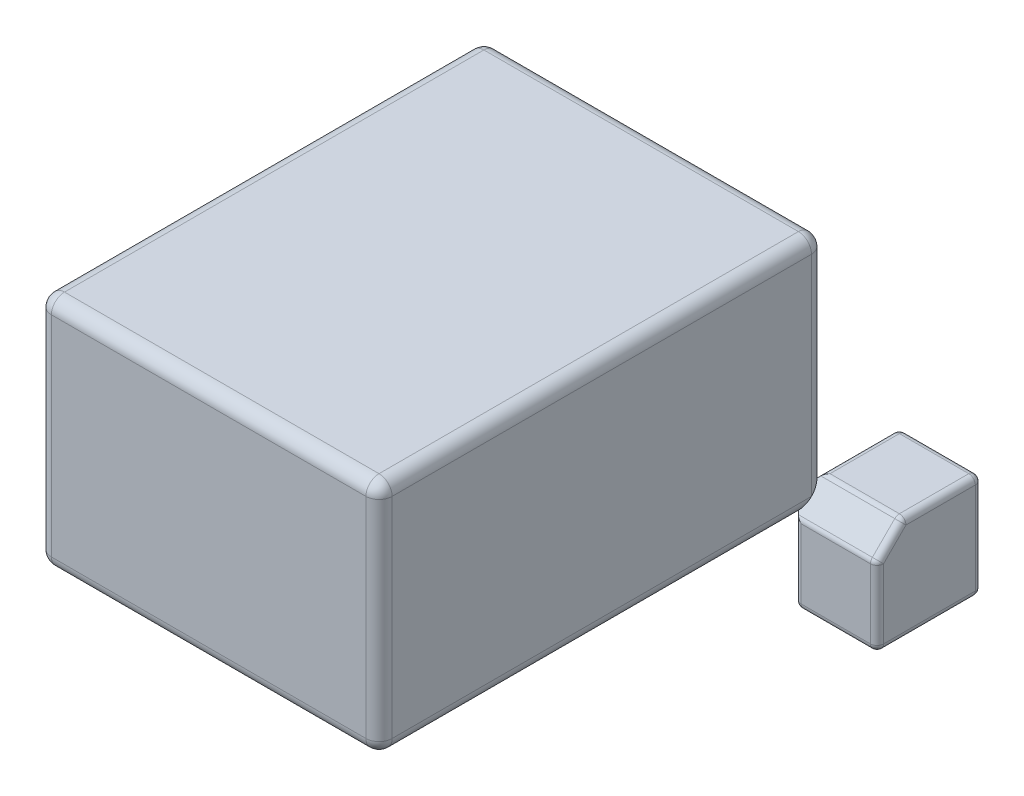
from build123d import *

# Parameters (mm, degrees)
SKETCH1_W                = 26
SKETCH1_H                = 18
BOSS_EXTRUDE1_DEPTH      = 34
SHELL1_T                 = 1
BOSS_EXTRUDE3_DEPTH      = 6
BOSS_EXTRUDE3_DEPTH_BACK = 2
SKETCH2_W                = 8
SKETCH2_H                = 8
CHAMFER2_SIZE            = 2
FILLET1_R                = 1
FILLET2_R                = 0.5


with BuildPart() as part:
    # Sketch1 → Boss-Extrude1 (new body)
    with BuildSketch(Plane.XY):
        with Locations((13, 9)):
            Rectangle(SKETCH1_W, SKETCH1_H)
    extrude(amount=BOSS_EXTRUDE1_DEPTH)

    # Shell1 (no face opened: a closed hollow body)
    add(offset(amount=-SHELL1_T, mode=Mode.PRIVATE), mode=Mode.SUBTRACT)

    # Sketch2 → Boss-Extrude3 (add, two sides: drawn at the far end of the back side and taken through both)
    with BuildSketch(Plane(origin=(0, 0, 0), x_dir=(-1, 0, 0), z_dir=(0, 0, -1)).offset(-BOSS_EXTRUDE3_DEPTH_BACK)):
        with Locations((-28, -2)):
            Rectangle(SKETCH2_W, SKETCH2_H)
    extrude(amount=BOSS_EXTRUDE3_DEPTH + BOSS_EXTRUDE3_DEPTH_BACK)

    # Chamfer2
    chamfer2_edges = [part.edges().sort_by_distance(p)[0] for p in [
        (24, -3, 2),
        (24, 2, -3),
        (29, 2, 2),
    ]]
    chamfer(chamfer2_edges, length=CHAMFER2_SIZE)

    # Fillet1
    # the kernel refuses this fillet: 1 mm, written as the material it takes off along each edge
    with BuildSketch(Plane(origin=(1, 17, 1), x_dir=(0, 1, 0), z_dir=(0, 0, -1))) as fillet1_piece_1_section:
        Polygon((0, 0), (FILLET1_R, 0), (FILLET1_R, -FILLET1_R), (0, -FILLET1_R), align=None)
    fillet1_piece_1 = extrude(amount=FILLET1_R, mode=Mode.PRIVATE)
    fillet1_piece_1 = fillet1_piece_1 - Plane(origin=(1, 17, 1), x_dir=(0.7071067811865476, -0.7071067811865475, 0), z_dir=(0, 0, -1)) * Sphere(FILLET1_R, mode=Mode.PRIVATE)
    add(fillet1_piece_1, mode=Mode.SUBTRACT)
    with BuildSketch(Plane(origin=(1, 1, 1), x_dir=(0, 0, -1), z_dir=(0, -1, 0))) as fillet1_piece_2_section:
        Polygon((0, 0), (FILLET1_R, 0), (FILLET1_R, -FILLET1_R), (0, -FILLET1_R), align=None)
    fillet1_piece_2 = extrude(amount=FILLET1_R, mode=Mode.PRIVATE)
    fillet1_piece_2 = fillet1_piece_2 - Plane(origin=(1, 1, 1), x_dir=(0.7071067811865475, 0, 0.7071067811865475), z_dir=(0, -1, 0)) * Sphere(FILLET1_R, mode=Mode.PRIVATE)
    add(fillet1_piece_2, mode=Mode.SUBTRACT)
    with BuildSketch(Plane(origin=(25, 17, 1), x_dir=(0, 0, -1), z_dir=(0, 1, 0))) as fillet1_piece_3_section:
        Polygon((0, 0), (FILLET1_R, 0), (FILLET1_R, -FILLET1_R), (0, -FILLET1_R), align=None)
    fillet1_piece_3 = extrude(amount=FILLET1_R, mode=Mode.PRIVATE)
    fillet1_piece_3 = fillet1_piece_3 - Plane(origin=(25, 17, 1), x_dir=(-0.7071067811865475, 0, 0.7071067811865475), z_dir=(0, 1, 0)) * Sphere(FILLET1_R, mode=Mode.PRIVATE)
    add(fillet1_piece_3, mode=Mode.SUBTRACT)
    with BuildSketch(Plane(origin=(1, 1, 33), x_dir=(-1, 0, 0), z_dir=(0, -1, 0))) as fillet1_piece_4_section:
        Polygon((0, 0), (FILLET1_R, 0), (FILLET1_R, -FILLET1_R), (0, -FILLET1_R), align=None)
    fillet1_piece_4 = extrude(amount=FILLET1_R, mode=Mode.PRIVATE)
    fillet1_piece_4 = fillet1_piece_4 - Plane(origin=(1, 1, 33), x_dir=(0.7071067811865475, 0, -0.7071067811865475), z_dir=(0, -1, 0)) * Sphere(FILLET1_R, mode=Mode.PRIVATE)
    add(fillet1_piece_4, mode=Mode.SUBTRACT)
    with BuildSketch(Plane(origin=(25, 1, 33), x_dir=(1, 0, 0), z_dir=(0, -1, 0))) as fillet1_piece_5_section:
        Polygon((0, 0), (FILLET1_R, 0), (FILLET1_R, FILLET1_R), (0, FILLET1_R), align=None)
    fillet1_piece_5 = extrude(amount=FILLET1_R, mode=Mode.PRIVATE)
    fillet1_piece_5 = fillet1_piece_5 - Plane(origin=(25, 1, 33), x_dir=(-0.7071067811865475, 0, -0.7071067811865475), z_dir=(0, -1, 0)) * Sphere(FILLET1_R, mode=Mode.PRIVATE)
    add(fillet1_piece_5, mode=Mode.SUBTRACT)
    with BuildSketch(Plane(origin=(25, 17, 33), x_dir=(1, 0, 0), z_dir=(0, 1, 0))) as fillet1_piece_6_section:
        Polygon((0, 0), (FILLET1_R, 0), (FILLET1_R, -FILLET1_R), (0, -FILLET1_R), align=None)
    fillet1_piece_6 = extrude(amount=FILLET1_R, mode=Mode.PRIVATE)
    fillet1_piece_6 = fillet1_piece_6 - Plane(origin=(25, 17, 33), x_dir=(-0.7071067811865475, 0, -0.7071067811865475), z_dir=(0, 1, 0)) * Sphere(FILLET1_R, mode=Mode.PRIVATE)
    add(fillet1_piece_6, mode=Mode.SUBTRACT)
    with BuildSketch(Plane(origin=(1, 17, 33), x_dir=(-1, 0, 0), z_dir=(0, 1, 0))) as fillet1_piece_7_section:
        Polygon((0, 0), (FILLET1_R, 0), (FILLET1_R, FILLET1_R), (0, FILLET1_R), align=None)
    fillet1_piece_7 = extrude(amount=FILLET1_R, mode=Mode.PRIVATE)
    fillet1_piece_7 = fillet1_piece_7 - Plane(origin=(1, 17, 33), x_dir=(0.7071067811865475, 0, -0.7071067811865475), z_dir=(0, 1, 0)) * Sphere(FILLET1_R, mode=Mode.PRIVATE)
    add(fillet1_piece_7, mode=Mode.SUBTRACT)
    with BuildSketch(Plane(origin=(0, 17, 0), x_dir=(1, 0, 0), z_dir=(0, -1, 0)), Plane(origin=(26, 1, 34), x_dir=(0, 0, -1), z_dir=(0, 1, 0)), Plane(origin=(0, 17, 34), x_dir=(0, 0, -1), z_dir=(0, -1, 0))) as fillet1_piece_8:
        with BuildLine():
            CenterArc((FILLET1_R, FILLET1_R), FILLET1_R, 180, 90)
            Line((0, FILLET1_R), (0, 0))
            Line((0, 0), (FILLET1_R, 0))
        make_face()
    extrude(amount=16, mode=Mode.SUBTRACT)
    with BuildSketch(Plane(origin=(1, 0, 0), x_dir=(0, 0, 1), z_dir=(1, 0, 0))) as fillet1_piece_9_section:
        with BuildLine():
            CenterArc((FILLET1_R, -FILLET1_R), FILLET1_R, 90, 90)
            Line((0, -FILLET1_R), (0, 0))
            Line((0, 0), (FILLET1_R, 0))
        make_face()
    fillet1_piece_9 = extrude(amount=25.5, mode=Mode.PRIVATE)
    fillet1_piece_9 = split(fillet1_piece_9, bisect_by=Plane(origin=(18.381826638, 0.226414546, -5.618173362), z_dir=(-0.7071067811865476, 0, 0.7071067811865476)), keep=Keep.TOP, mode=Mode.PRIVATE)
    fillet1_piece_9 = split(fillet1_piece_9, bisect_by=Plane(origin=(18.381826638, -5.618173362, 0.226414546), z_dir=(-0.7071067811865475, 0.7071067811865476, 0)), keep=Keep.TOP, mode=Mode.PRIVATE)
    add(fillet1_piece_9, mode=Mode.SUBTRACT)
    with BuildSketch(Plane(origin=(1, 0, 0), x_dir=(0, 0, 1), z_dir=(1, 0, 0))) as fillet1_piece_10_section:
        with BuildLine():
            CenterArc((FILLET1_R, -FILLET1_R), FILLET1_R, 90, 90)
            Line((0, -FILLET1_R), (0, 0))
            Line((0, 0), (FILLET1_R, 0))
        make_face()
    fillet1_piece_10 = extrude(amount=25.5, mode=Mode.PRIVATE)
    fillet1_piece_10 = split(fillet1_piece_10, bisect_by=Plane(origin=(24.16446835, 0.528927527, 0.16446835), z_dir=(0.7071067811865476, 0, -0.7071067811865476)), keep=Keep.TOP, mode=Mode.PRIVATE)
    fillet1_piece_10 = split(fillet1_piece_10, bisect_by=Plane(origin=(24.407441135, 0.407441135, 0.042981958), z_dir=(-0.7071067811865475, 0.7071067811865476, 0)), keep=Keep.TOP, mode=Mode.PRIVATE)
    add(fillet1_piece_10, mode=Mode.SUBTRACT)
    with BuildSketch(Plane(origin=(1, 0, 0), x_dir=(0, 0, 1), z_dir=(1, 0, 0))) as fillet1_piece_11_section:
        with BuildLine():
            CenterArc((FILLET1_R, -FILLET1_R), FILLET1_R, 90, 90)
            Line((0, -FILLET1_R), (0, 0))
            Line((0, 0), (FILLET1_R, 0))
        make_face()
    fillet1_piece_11 = extrude(amount=25.5, mode=Mode.PRIVATE)
    fillet1_piece_11 = split(fillet1_piece_11, bisect_by=Plane(origin=(24.407441135, 0.042981958, 0.407441135), z_dir=(-0.7071067811865476, 0, 0.7071067811865476)), keep=Keep.TOP, mode=Mode.PRIVATE)
    fillet1_piece_11 = split(fillet1_piece_11, bisect_by=Plane(origin=(24.16446835, 0.16446835, 0.528927527), z_dir=(0.7071067811865475, -0.7071067811865476, 0)), keep=Keep.TOP, mode=Mode.PRIVATE)
    add(fillet1_piece_11, mode=Mode.SUBTRACT)
    with BuildSketch(Plane(origin=(26, -0.5, 0), x_dir=(-1, 0, 0), z_dir=(0, 1, 0))) as fillet1_piece_12_section:
        with BuildLine():
            CenterArc((FILLET1_R, FILLET1_R), FILLET1_R, 180, 90)
            Line((0, FILLET1_R), (0, 0))
            Line((0, 0), (FILLET1_R, 0))
        make_face()
    fillet1_piece_12 = extrude(amount=17.5, mode=Mode.PRIVATE)
    fillet1_piece_12 = split(fillet1_piece_12, bisect_by=Plane(origin=(25.83553165, 1.83553165, 0.528927527), z_dir=(0.7071067811865475, -0.7071067811865476, 0)), keep=Keep.TOP, mode=Mode.PRIVATE)
    fillet1_piece_12 = split(fillet1_piece_12, bisect_by=Plane(origin=(25.957018042, 1.592558865, 0.407441135), z_dir=(0, 0.7071067811865476, 0.7071067811865476)), keep=Keep.TOP, mode=Mode.PRIVATE)
    add(fillet1_piece_12, mode=Mode.SUBTRACT)
    with BuildSketch(Plane(origin=(26, -0.5, 0), x_dir=(-1, 0, 0), z_dir=(0, 1, 0))) as fillet1_piece_13_section:
        with BuildLine():
            CenterArc((FILLET1_R, FILLET1_R), FILLET1_R, 180, 90)
            Line((0, FILLET1_R), (0, 0))
            Line((0, 0), (FILLET1_R, 0))
        make_face()
    fillet1_piece_13 = extrude(amount=17.5, mode=Mode.PRIVATE)
    fillet1_piece_13 = split(fillet1_piece_13, bisect_by=Plane(origin=(25.592558865, 1.592558865, 0.042981958), z_dir=(-0.7071067811865475, 0.7071067811865476, 0)), keep=Keep.TOP, mode=Mode.PRIVATE)
    fillet1_piece_13 = split(fillet1_piece_13, bisect_by=Plane(origin=(25.471072473, 1.83553165, 0.16446835), z_dir=(0, -0.7071067811865476, -0.7071067811865476)), keep=Keep.TOP, mode=Mode.PRIVATE)
    add(fillet1_piece_13, mode=Mode.SUBTRACT)
    with BuildSketch(Plane(origin=(26, -0.5, 0), x_dir=(-1, 0, 0), z_dir=(0, 1, 0))) as fillet1_piece_14_section:
        with BuildLine():
            CenterArc((FILLET1_R, FILLET1_R), FILLET1_R, 180, 90)
            Line((0, FILLET1_R), (0, 0))
            Line((0, 0), (FILLET1_R, 0))
        make_face()
    fillet1_piece_14 = extrude(amount=17.5, mode=Mode.PRIVATE)
    fillet1_piece_14 = split(fillet1_piece_14, bisect_by=Plane(origin=(29.618138272, 5.618138272, 0.226424858), z_dir=(-0.7071067811865475, 0.7071067811865476, 0)), keep=Keep.TOP, mode=Mode.PRIVATE)
    fillet1_piece_14 = split(fillet1_piece_14, bisect_by=Plane(origin=(25.773575142, 5.618138272, -3.618138272), z_dir=(0, 0.7071067811865476, 0.7071067811865476)), keep=Keep.TOP, mode=Mode.PRIVATE)
    add(fillet1_piece_14, mode=Mode.SUBTRACT)
    with BuildSketch(Plane(origin=(25, 18, 0), x_dir=(0, -1, 0), z_dir=(-1, 0, 0)), Plane(origin=(1, 0, 34), x_dir=(0, 0, -1), z_dir=(1, 0, 0))) as fillet1_piece_15:
        with BuildLine():
            CenterArc((FILLET1_R, FILLET1_R), FILLET1_R, 180, 90)
            Line((0, FILLET1_R), (0, 0))
            Line((0, 0), (FILLET1_R, 0))
        make_face()
    extrude(amount=24, mode=Mode.SUBTRACT)
    with BuildSketch(Plane(origin=(25, 18, 34), x_dir=(0, -1, 0), z_dir=(-1, 0, 0))) as fillet1_piece_16:
        with BuildLine():
            CenterArc((FILLET1_R, -FILLET1_R), FILLET1_R, 90, 90)
            Line((0, -FILLET1_R), (0, 0))
            Line((0, 0), (FILLET1_R, 0))
        make_face()
    extrude(amount=24, mode=Mode.SUBTRACT)
    with BuildSketch(Plane(origin=(0, 18, 1), x_dir=(0, -1, 0), z_dir=(0, 0, 1)), Plane(origin=(0, 0, 1), x_dir=(1, 0, 0), z_dir=(0, 0, 1))) as fillet1_piece_17:
        with BuildLine():
            CenterArc((FILLET1_R, FILLET1_R), FILLET1_R, 180, 90)
            Line((0, FILLET1_R), (0, 0))
            Line((0, 0), (FILLET1_R, 0))
        make_face()
    extrude(amount=32, mode=Mode.SUBTRACT)
    with BuildSketch(Plane(origin=(26, 18, 1), x_dir=(0, -1, 0), z_dir=(0, 0, 1))) as fillet1_piece_18:
        with BuildLine():
            CenterArc((FILLET1_R, -FILLET1_R), FILLET1_R, 90, 90)
            Line((0, -FILLET1_R), (0, 0))
            Line((0, 0), (FILLET1_R, 0))
        make_face()
    extrude(amount=32, mode=Mode.SUBTRACT)
    with BuildSketch(Plane(origin=(26, 0, -0.5), x_dir=(-1, 0, 0), z_dir=(0, 0, 1))) as fillet1_piece_19_section:
        with BuildLine():
            CenterArc((FILLET1_R, -FILLET1_R), FILLET1_R, 90, 90)
            Line((0, -FILLET1_R), (0, 0))
            Line((0, 0), (FILLET1_R, 0))
        make_face()
    fillet1_piece_19 = extrude(amount=33.5, mode=Mode.PRIVATE)
    fillet1_piece_19 = split(fillet1_piece_19, bisect_by=Plane(origin=(25.83553165, 0.528927527, 1.83553165), z_dir=(0.7071067811865476, 0, -0.7071067811865476)), keep=Keep.TOP, mode=Mode.PRIVATE)
    fillet1_piece_19 = split(fillet1_piece_19, bisect_by=Plane(origin=(25.957018042, 0.407441135, 1.592558865), z_dir=(0, 0.7071067811865476, 0.7071067811865476)), keep=Keep.TOP, mode=Mode.PRIVATE)
    add(fillet1_piece_19, mode=Mode.SUBTRACT)
    with BuildSketch(Plane(origin=(26, 0, -0.5), x_dir=(-1, 0, 0), z_dir=(0, 0, 1))) as fillet1_piece_20_section:
        with BuildLine():
            CenterArc((FILLET1_R, -FILLET1_R), FILLET1_R, 90, 90)
            Line((0, -FILLET1_R), (0, 0))
            Line((0, 0), (FILLET1_R, 0))
        make_face()
    fillet1_piece_20 = extrude(amount=33.5, mode=Mode.PRIVATE)
    fillet1_piece_20 = split(fillet1_piece_20, bisect_by=Plane(origin=(25.592558865, 0.042981958, 1.592558865), z_dir=(-0.7071067811865476, 0, 0.7071067811865476)), keep=Keep.TOP, mode=Mode.PRIVATE)
    fillet1_piece_20 = split(fillet1_piece_20, bisect_by=Plane(origin=(25.471072473, 0.16446835, 1.83553165), z_dir=(0, -0.7071067811865476, -0.7071067811865476)), keep=Keep.TOP, mode=Mode.PRIVATE)
    add(fillet1_piece_20, mode=Mode.SUBTRACT)
    with BuildSketch(Plane(origin=(26, 0, -0.5), x_dir=(-1, 0, 0), z_dir=(0, 0, 1))) as fillet1_piece_21_section:
        with BuildLine():
            CenterArc((FILLET1_R, -FILLET1_R), FILLET1_R, 90, 90)
            Line((0, -FILLET1_R), (0, 0))
            Line((0, 0), (FILLET1_R, 0))
        make_face()
    fillet1_piece_21 = extrude(amount=33.5, mode=Mode.PRIVATE)
    fillet1_piece_21 = split(fillet1_piece_21, bisect_by=Plane(origin=(33.618190384, 0.226409543, 9.618190384), z_dir=(-0.7071067811865476, 0, 0.7071067811865476)), keep=Keep.TOP, mode=Mode.PRIVATE)
    fillet1_piece_21 = split(fillet1_piece_21, bisect_by=Plane(origin=(25.773590457, -7.618190384, 9.618190384), z_dir=(0, 0.7071067811865476, 0.7071067811865476)), keep=Keep.TOP, mode=Mode.PRIVATE)
    add(fillet1_piece_21, mode=Mode.SUBTRACT)

    # Fillet2
    fillet2_edges = [part.edges().sort_by_distance(p)[0] for p in [
        (28, -6, -6),
        (32, -6, -2),
        (32, -2, -6),
        (32, 2, -3),
        (29, 2, -6),
        (26, 2, -3),
        (29, 2, 0),
        (32, -3, 2),
        (32, 1, 1),
        (29, -6, 2),
        (26, -3, 2),
        (29, 0, 2),
        (24, -3, -6),
        (24, -6, -3),
        (24, -3, 0),
        (24, 0, -3),
        (25, 1, -6),
        (25, -6, 1),
    ]]
    fillet(fillet2_edges, radius=FILLET2_R)


solid = part.part
